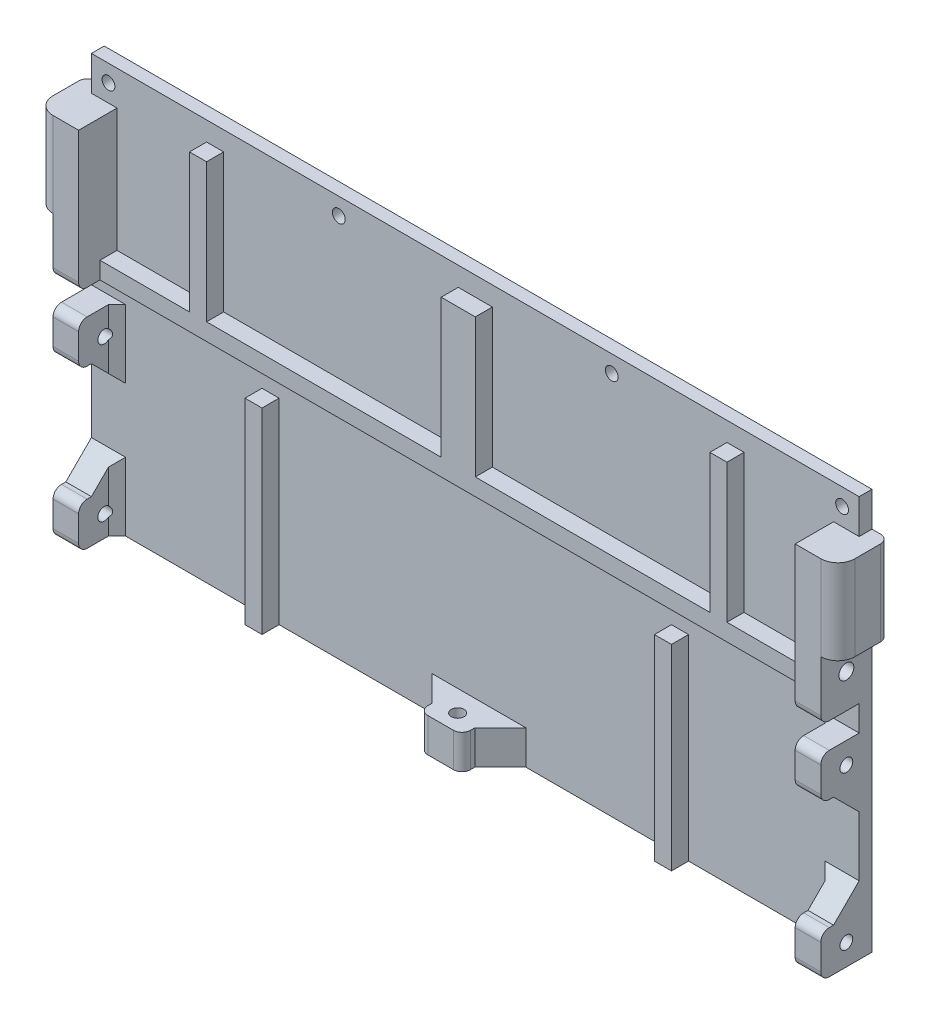
from build123d import *

# Parameters (mm, degrees)
SKETCH_1_W          = 180
SKETCH_1_H          = 94
EXTRUDE_1_DEPTH     = 3
SKETCH_2_W          = 6
SKETCH_2_H          = 10
SKETCH_2_H_2        = 33.9
SKETCH_2_H_3        = 32.9
SKETCH_2_W_2        = 10
SKETCH_2_H_4        = 8
EXTRUDE_2_DEPTH     = 9
CHAMFER_2_SIZE      = 6
CHAMFER_1_SIZE      = 6
CUT_EXTRUDE_1_REACH = 205.421
SKETCH_3_R          = 1.5
SKETCH_3_R_2        = 1.75
SKETCH_4_R          = 1.5
CUT_EXTRUDE_2_DEPTH = 204.265835791
SKETCH_5_W          = 4
SKETCH_5_H          = 46
EXTRUDE_3_DEPTH     = 4
CHAMFER_3_SIZE      = 2
SKETCH_6_W          = 12
SKETCH_6_H          = 19.9
EXTRUDE_4_DEPTH     = 4
FILLET_1_R          = 4
SKETCH_7_W          = 12
SKETCH_7_H          = 19.9
EXTRUDE_5_DEPTH     = 4
FILLET_2_R          = 4
FILLET_3_R          = 2
SKETCH_8_R          = 1.5
CUT_EXTRUDE_3_DEPTH = 10
CUT_EXTRUDE_4_REACH = 208.969
SKETCH_9_R          = 1.5
CHAMFER_4_SIZE      = 6
FILLET_4_R          = 2


with BuildPart() as part:
    # Эскиз1 → Бобышка-Вытянуть1 (new body)
    with BuildSketch(Plane.XY):
        with Locations((90, -47)):
            Rectangle(SKETCH_1_W, SKETCH_1_H)
    extrude(amount=EXTRUDE_1_DEPTH)

    # Эскиз2 → Бобышка-Вытянуть2 (add)
    with BuildSketch(Plane.XY.offset(3)):
        with Locations((3, -89)):
            Rectangle(SKETCH_2_W, SKETCH_2_H)
        with Locations((177, -89)):
            Rectangle(SKETCH_2_W, SKETCH_2_H)
        with Locations((3, -52)):
            Rectangle(SKETCH_2_W, SKETCH_2_H)
        with Locations((177, -53)):
            Rectangle(SKETCH_2_W, SKETCH_2_H)
        with Locations((177, -25.05)):
            Rectangle(SKETCH_2_W, SKETCH_2_H_2)
        with Locations((3, -24.55)):
            Rectangle(SKETCH_2_W, SKETCH_2_H_3)
        with Locations((90.875995779, -90)):
            Rectangle(SKETCH_2_W_2, SKETCH_2_H_4)
    extrude(amount=EXTRUDE_2_DEPTH)

    # Фаска2
    chamfer_2_edges = [part.edges().sort_by_distance(p)[0] for p in [
        (3, -57, 3),
        (177, -58, 3),
    ]]
    chamfer(chamfer_2_edges, length=CHAMFER_2_SIZE)

    # Фаска1
    chamfer_1_edges = [part.edges().sort_by_distance(p)[0] for p in [
        (3, -84, 3),
        (177, -84, 3),
    ]]
    chamfer(chamfer_1_edges, length=CHAMFER_1_SIZE)

    # Эскиз3 → Вырез-Вытянуть1 (cut, up to next)
    with BuildSketch(Plane(origin=(180, 0, 0), x_dir=(0, 0, -1), z_dir=(1, 0, 0)), mode=Mode.PRIVATE) as cut_extrude_1_sk1:
        with Locations((-6, -89)):
            Circle(SKETCH_3_R)
    cut_extrude_1_tool1 = extrude(cut_extrude_1_sk1.sketch, amount=-CUT_EXTRUDE_1_REACH, mode=Mode.PRIVATE) & part.part
    # Эскиз3 → Вырез-Вытянуть1 (cut, up to next)
    with BuildSketch(Plane(origin=(180, 0, 0), x_dir=(0, 0, -1), z_dir=(1, 0, 0)), mode=Mode.PRIVATE) as cut_extrude_1_sk2:
        with Locations((-6, -53)):
            Circle(SKETCH_3_R)
    cut_extrude_1_tool2 = extrude(cut_extrude_1_sk2.sketch, amount=-CUT_EXTRUDE_1_REACH, mode=Mode.PRIVATE) & part.part
    # Эскиз3 → Вырез-Вытянуть1 (cut, up to next)
    with BuildSketch(Plane(origin=(180, 0, 0), x_dir=(0, 0, -1), z_dir=(1, 0, 0)), mode=Mode.PRIVATE) as cut_extrude_1_sk3:
        with Locations((-6, -34)):
            Circle(SKETCH_3_R_2)
    cut_extrude_1_tool3 = extrude(cut_extrude_1_sk3.sketch, amount=-CUT_EXTRUDE_1_REACH, mode=Mode.PRIVATE) & part.part
    add(cut_extrude_1_tool1.solids().sort_by_distance((180, -89, 6))[0], mode=Mode.SUBTRACT)
    add(cut_extrude_1_tool2.solids().sort_by_distance((180, -53, 6))[0], mode=Mode.SUBTRACT)
    add(cut_extrude_1_tool3.solids().sort_by_distance((180, -34, 6))[0], mode=Mode.SUBTRACT)

    # Эскиз4 → Вырез-Вытянуть2 (cut, through all)
    with BuildSketch(Plane.XY.offset(3)):
        with Locations((4, -4)):
            Circle(SKETCH_4_R)
        with Locations((176, -4)):
            Circle(SKETCH_4_R)
        with Locations((58, -4)):
            Circle(SKETCH_4_R)
        with Locations((122, -4)):
            Circle(SKETCH_4_R)
    extrude(amount=-CUT_EXTRUDE_2_DEPTH, mode=Mode.SUBTRACT)

    # Эскиз5 → Бобышка-Вытянуть3 (add)
    with BuildSketch(Plane.XY.offset(3)):
        with Locations((42, -71)):
            Rectangle(SKETCH_5_W, SKETCH_5_H)
        with Locations((138, -71)):
            Rectangle(SKETCH_5_W, SKETCH_5_H)
        Polygon((27, -4.5), (27, -37), (6, -37), (6, -41), (174, -41), (174, -37), (153, -37), (153, -4.5), (149, -4.5), (149, -37), (94, -37), (94, -4.5), (86, -4.5), (86, -37), (31, -37), (31, -4.5), align=None)
    extrude(amount=EXTRUDE_3_DEPTH)

    # Фаска3
    # the kernel refuses this chamfer: 2 mm, written as the material it adds along each edge
    with BuildSketch(Plane(origin=(6, -72.856634024, 3), x_dir=(0.9996219169112968, 0, -0.02749587661058627), z_dir=(0, -1, 0))) as chamfer_3_piece_1_section:
        Polygon((CHAMFER_3_SIZE * 0.999621916911, CHAMFER_3_SIZE * 0.0274958766106), (-CHAMFER_3_SIZE * 0.0274958766106, CHAMFER_3_SIZE * 0.999621916911), (0, 0), align=None)
    chamfer_3_piece_1 = extrude(amount=21.143365976, mode=Mode.PRIVATE)
    chamfer_3_piece_1 = split(chamfer_3_piece_1, bisect_by=Plane(origin=(6.668439358, -82.482271763, 7.482271763), z_dir=(0, -0.7071067811865476, -0.7071067811865476)), keep=Keep.TOP, mode=Mode.PRIVATE)
    add(chamfer_3_piece_1)
    with BuildSketch(Plane(origin=(174, -94, 3), x_dir=(-0.9996219169112968, 0, -0.02749587661058639), z_dir=(0, 1, 0))) as chamfer_3_piece_2_section:
        Polygon((CHAMFER_3_SIZE * 0.999621916911, CHAMFER_3_SIZE * 0.0274958766106), (-CHAMFER_3_SIZE * 0.0274958766106, CHAMFER_3_SIZE * 0.999621916911), (0, 0), align=None)
    chamfer_3_piece_2 = extrude(amount=21.143365976, mode=Mode.PRIVATE)
    chamfer_3_piece_2 = split(chamfer_3_piece_2, bisect_by=Plane(origin=(173.327651835, -82.469530213, 7.469530213), z_dir=(2.038461385028344e-15, -0.7071067811865476, -0.7071067811865476)), keep=Keep.TOP, mode=Mode.PRIVATE)
    chamfer_3_piece_2 = chamfer_3_piece_2 - Plane(origin=(173.327651835, -89, 6), x_dir=(0, 0, -1), z_dir=(1, 0, 0)) * Cylinder(1.5, 51, mode=Mode.PRIVATE)
    add(chamfer_3_piece_2)
    with BuildSketch(Plane(origin=(6, -47, 3), x_dir=(0.9996219169112968, 0, -0.02749587661058627), z_dir=(0, -1, 0))) as chamfer_3_piece_3_section:
        Polygon((CHAMFER_3_SIZE * 0.999621916911, CHAMFER_3_SIZE * 0.0274958766106), (-CHAMFER_3_SIZE * 0.0274958766106, CHAMFER_3_SIZE * 0.999621916911), (0, 0), align=None)
    chamfer_3_piece_3 = extrude(amount=21.143365976, mode=Mode.PRIVATE)
    chamfer_3_piece_3 = split(chamfer_3_piece_3, bisect_by=Plane(origin=(6.668439358, -58.517728237, 7.482271763), z_dir=(0, 0.7071067811865476, -0.7071067811865476)), keep=Keep.TOP, mode=Mode.PRIVATE)
    add(chamfer_3_piece_3)
    with BuildSketch(Plane(origin=(174, -69.143365976, 3), x_dir=(-0.9996219169112968, 0, -0.02749587661058639), z_dir=(0, 1, 0))) as chamfer_3_piece_4_section:
        Polygon((CHAMFER_3_SIZE * 0.999621916911, CHAMFER_3_SIZE * 0.0274958766106), (-CHAMFER_3_SIZE * 0.0274958766106, CHAMFER_3_SIZE * 0.999621916911), (0, 0), align=None)
    chamfer_3_piece_4 = extrude(amount=21.143365976, mode=Mode.PRIVATE)
    chamfer_3_piece_4 = split(chamfer_3_piece_4, bisect_by=Plane(origin=(173.327651834, -59.530469789, 7.469530211), z_dir=(0, 0.7071067811865476, -0.7071067811865476)), keep=Keep.TOP, mode=Mode.PRIVATE)
    chamfer_3_piece_4 = chamfer_3_piece_4 - Plane(origin=(173.327651834, -53, 6), x_dir=(0, 0, -1), z_dir=(1, 0, 0)) * Cylinder(1.5, 51, mode=Mode.PRIVATE)
    add(chamfer_3_piece_4)

    # Эскиз6 → Бобышка-Вытянуть4 (add)
    with BuildSketch(Plane(origin=(180, 0, 0), x_dir=(0, 0, -1), z_dir=(1, 0, 0))):
        with Locations((-6, -18.05)):
            Rectangle(SKETCH_6_W, SKETCH_6_H)
    extrude(amount=EXTRUDE_4_DEPTH)

    # Скругление1
    fillet_1_edges = [part.edges().sort_by_distance(p)[0] for p in [
        (184, -18.05, 12),
    ]]
    fillet(fillet_1_edges, radius=FILLET_1_R)

    # Эскиз7 → Бобышка-Вытянуть5 (add)
    with BuildSketch(Plane.ZY):
        with Locations((6, -18.05)):
            Rectangle(SKETCH_7_W, SKETCH_7_H)
    extrude(amount=EXTRUDE_5_DEPTH)

    # Скругление2
    fillet_2_edges = [part.edges().sort_by_distance(p)[0] for p in [
        (-4, -18.05, 12),
    ]]
    fillet(fillet_2_edges, radius=FILLET_2_R)

    # Скругление3
    fillet_3_edges = [part.edges().sort_by_distance(p)[0] for p in [
        (184, -18.05, 0),
        (-4, -18.05, 0),
    ]]
    fillet(fillet_3_edges, radius=FILLET_3_R)

    # Эскиз8 → Вырез-Вытянуть3 (cut)
    with BuildSketch(Plane.XZ.offset(94)):
        with Locations(Location((90.875995779, 8, 0), (0, 0, 270))):
            Circle(SKETCH_8_R)
    extrude(amount=-CUT_EXTRUDE_3_DEPTH, mode=Mode.SUBTRACT)

    # Эскиз9 → Вырез-Вытянуть4 (cut, up to next)
    with BuildSketch(Plane.ZY, mode=Mode.PRIVATE) as cut_extrude_4_sk1:
        with Locations(Location((6, -89, 0), (0, 0, 180))):
            Circle(SKETCH_9_R)
    cut_extrude_4_tool1 = extrude(cut_extrude_4_sk1.sketch, amount=-CUT_EXTRUDE_4_REACH, mode=Mode.PRIVATE) & part.part
    # Эскиз9 → Вырез-Вытянуть4 (cut, up to next)
    with BuildSketch(Plane.ZY, mode=Mode.PRIVATE) as cut_extrude_4_sk2:
        with Locations(Location((6, -53, 0), (0, 0, 180))):
            Circle(SKETCH_9_R)
    cut_extrude_4_tool2 = extrude(cut_extrude_4_sk2.sketch, amount=-CUT_EXTRUDE_4_REACH, mode=Mode.PRIVATE) & part.part
    add(cut_extrude_4_tool1.solids().sort_by_distance((0, -89, 6))[0], mode=Mode.SUBTRACT)
    add(cut_extrude_4_tool2.solids().sort_by_distance((0, -53, 6))[0], mode=Mode.SUBTRACT)

    # Фаска4
    chamfer_4_edges = [part.edges().sort_by_distance(p)[0] for p in [
        (85.875995779, -90, 3),
        (95.875995779, -90, 3),
    ]]
    chamfer(chamfer_4_edges, length=CHAMFER_4_SIZE)

    # Скругление4
    fillet_4_edges = [part.edges().sort_by_distance(p)[0] for p in [
        (177, -84, 12),
        (3, -84, 12),
        (3, -41, 12),
        (3, -47, 12),
        (3, -57, 12),
        (3, -94, 12),
        (177, -42, 12),
        (177, -48, 12),
        (177, -58, 12),
        (85.875995779, -90, 12),
        (95.875995779, -90, 12),
        (177, -94, 12),
    ]]
    fillet(fillet_4_edges, radius=FILLET_4_R)


solid = part.part
